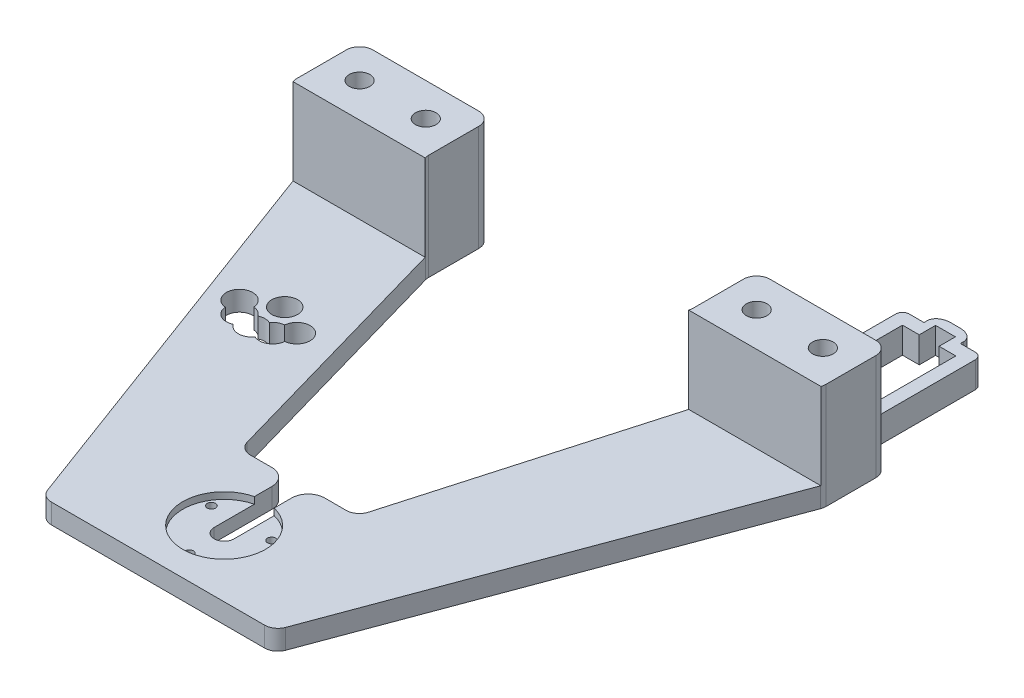
from build123d import *

# Parameters (mm, degrees)
SKETCH1_R            = 3.96875
BOSS_EXTRUDE2_DEPTH  = 40.64
SKETCH4_R            = 1.5875
CUT_EXTRUDE1_DEPTH   = 210.749095026
CUT_EXTRUDE2_START   = 5.08
SKETCH5_R            = 15.875
CUT_EXTRUDE2_DEPTH   = 5.08
SKETCH7_W            = 321.437634852
SKETCH7_H            = 153.081921076
CUT_EXTRUDE3_DEPTH   = 33.02
CUT_EXTRUDE5_DEPTH   = 210.749095026
FILLET1_R            = 6.35
FILLET2_R            = 6.35
EXTRUDE_THIN1_DEPTH  = 10
SKETCH14_R           = 1.950000064
CUT_EXTRUDE6_DEPTH   = 20
BOSS_EXTRUDE4_DEPTH  = 5
MIRROR5_COPY_1_DEPTH = 5
FILLET3_R            = 2.54
SKETCH20_W           = 13.97
SKETCH20_H           = 5.08
BOSS_EXTRUDE5_DEPTH  = 10
FILLET7_SIZE         = 3.81
FILLET7_SIZE_2       = 5.08
FILLET6_SIZE         = 3.81
FILLET6_SIZE_2       = 5.08
CUT_EXTRUDE10_START  = -5
SKETCH19_W           = 7.62
SKETCH19_H           = 10.16
CUT_EXTRUDE10_DEPTH  = 6.27
MIRROR6_OUTLINE_W    = 7.62
MIRROR6_OUTLINE_H    = 5
MIRROR6_DEPTH        = 10
MIRROR6_2_DEPTH      = 10
SKETCH21_W           = 77.087164644
SKETCH21_H           = 69.073945867
CUT_EXTRUDE11_DEPTH  = 210.74909516
SKETCH23_R           = 5.08
CUT_EXTRUDE12_DEPTH  = 255.54404949
SKETCH22_R           = 4.953
CUT_EXTRUDE13_DEPTH  = 255.54404949


# Read off the part's stored shape, not the designer's step: Mirror6
with BuildPart() as part:
    # Sketch1 → Boss-Extrude2 (new body)
    with BuildSketch(Plane(origin=(0, 0, 0), x_dir=(1, 0, 0), z_dir=(0, 1, 0))):
        with BuildLine():
            Line((-96.52, 178.942765331), (-55.88, 178.942765331))
            ThreePointArc((-55.88, 178.942765331), (-52.287897552, 177.454867779), (-50.8, 173.862765331))
            Line((-50.8, 173.862765331), (-50.8, 154.610881096))
            ThreePointArc((-50.8, 154.610881096), (-50.750979429, 153.906859803), (-50.604863787, 153.216425724))
            Line((-50.604863787, 153.216425724), (-23.277092285, 57.485544628))
            ThreePointArc((-23.277092285, 57.485544628), (-21.451849938, 54.824742099), (-18.392228498, 53.8))
            Line((-18.392228498, 53.8), (0, 53.8))
            Line((0, 53.8), (0, 0))
            Line((0, 0), (-40.91748188, 0))
            ThreePointArc((-40.91748188, 0), (-43.817717665, 0.909264766), (-45.679732106, 3.31156205))
            Line((-45.679732106, 3.31156205), (-101.282250226, 153.044327381))
            ThreePointArc((-101.282250226, 153.044327381), (-101.519931557, 153.914386555), (-101.6, 154.812765331))
            Line((-101.6, 154.812765331), (-101.6, 173.862765331))
            ThreePointArc((-101.6, 173.862765331), (-100.112102448, 177.454867779), (-96.52, 178.942765331))
        make_face()
        with Locations(Location((-88.9, 166.242765331, 0), (0, 0, 270))):
            Circle(SKETCH1_R, mode=Mode.SUBTRACT)
        with Locations(Location((-63.5, 166.242765331, 0), (0, 0, 270))):
            Circle(SKETCH1_R, mode=Mode.SUBTRACT)
    boss_extrude2 = extrude(amount=BOSS_EXTRUDE2_DEPTH)

    # Mirror1: Boss-Extrude2 across plane
    add(boss_extrude2.mirror(Plane(origin=(0, 40.64, -53.8), x_dir=(0, 0, 1), z_dir=(-1, 0, 0))))

    # Sketch4 → Cut-Extrude1 (cut, through all)
    with BuildSketch(Plane(origin=(0, 40.64, 0), x_dir=(1, 0, 0), z_dir=(0, 1, 0))):
        with Locations(Location((11.548448759, 32.0195, 0), (0, 0, 270))):
            Circle(SKETCH4_R)
        with Locations(Location((0, 12.017, 0), (0, 0, 270))):
            Circle(SKETCH4_R)
        with Locations(Location((-11.548448759, 32.0195, 0), (0, 0, 270))):
            Circle(SKETCH4_R)
    extrude(amount=-CUT_EXTRUDE1_DEPTH, mode=Mode.SUBTRACT)

    # Sketch5 → Cut-Extrude2 (cut)
    with BuildSketch(Plane(origin=(0, 0, 0), x_dir=(1, 0, 0), z_dir=(0, 1, 0)).offset(CUT_EXTRUDE2_START)):
        with Locations(Location((0, 25.352, 0), (0, 0, 270))):
            Circle(SKETCH5_R)
    extrude(amount=CUT_EXTRUDE2_DEPTH, mode=Mode.SUBTRACT)

    # Sketch7 → Cut-Extrude3 (cut)
    with BuildSketch(Plane(origin=(0, 40.64, 0), x_dir=(1, 0, 0), z_dir=(0, 1, 0))):
        with Locations((5.589227859, 76.540960538)):
            Rectangle(SKETCH7_W, SKETCH7_H)
    extrude(amount=-CUT_EXTRUDE3_DEPTH, mode=Mode.SUBTRACT)

    # Sketch8 → Cut-Extrude5 (cut, through all)
    with BuildSketch(Plane(origin=(0, 0, 0), x_dir=(1, 0, 0), z_dir=(0, 1, 0))):
        with BuildLine():
            Line((-3.81, 25.352), (-3.81, 53.8))
            ThreePointArc((-3.81, 53.8), (0, 57.61), (3.81, 53.8))
            Line((3.81, 53.8), (3.81, 25.352))
            ThreePointArc((3.81, 25.352), (0, 21.542), (-3.81, 25.352))
        make_face()
    extrude(amount=CUT_EXTRUDE5_DEPTH, mode=Mode.SUBTRACT)

    # Fillet1
    fillet1_edges = [part.edges().sort_by_distance(p)[0] for p in [
        (-3.81, 3.81, -53.8),
    ]]
    fillet(fillet1_edges, radius=FILLET1_R)

    # Fillet2
    fillet2_edges = [part.edges().sort_by_distance(p)[0] for p in [
        (3.81, 3.81, -53.8),
    ]]
    fillet(fillet2_edges, radius=FILLET2_R)

    # Sketch9 → Extrude-Thin1 (add)
    with BuildSketch(Plane(origin=(0, 0, 0), x_dir=(1, 0, 0), z_dir=(0, 1, 0))):
        Polygon((-91.44, 173.942765331), (-91.44, 224.742765331), (-60.96, 224.742765331), (-60.96, 173.942765331), (-65.96, 173.942765331), (-65.96, 219.742765331), (-86.44, 219.742765331), (-86.44, 173.942765331), align=None)
    extrude_thin1 = extrude(amount=EXTRUDE_THIN1_DEPTH)

    # Sketch14 → Cut-Extrude6 (cut)
    with BuildSketch(Plane.XZ):
        with Locations(Location((-81.2, -174.942765331, 0), (0, 0, 270))):
            Circle(SKETCH14_R)
        with Locations(Location((-71.2, -174.942765331, 0), (0, 0, 270))):
            Circle(SKETCH14_R)
    cut_extrude6 = extrude(amount=-CUT_EXTRUDE6_DEPTH, mode=Mode.SUBTRACT)

    # Sketch18 → Boss-Extrude4 (add)
    with BuildSketch(Plane(origin=(-60.96, 10, -178.942765331), x_dir=(0, 0, 1), z_dir=(-1, 0, 0))):
        Polygon((-1.27, 0), (0, 1.524), (0, 0), align=None)
    boss_extrude4 = extrude(amount=BOSS_EXTRUDE4_DEPTH)

    # Mirror3: Boss-Extrude4 across plane
    add(boss_extrude4.mirror(Plane(origin=(-76.2, 0, 0), x_dir=(0, 0, 1), z_dir=(1, 0, 0))))

    # Mirror5: Extrude-Thin1, Cut-Extrude6, Boss-Extrude4 across plane
    add(extrude_thin1.mirror(Plane(origin=(0, 0, 0), x_dir=(0, 0, 1), z_dir=(1, 0, 0))))
    add(cut_extrude6.mirror(Plane(origin=(0, 0, 0), x_dir=(0, 0, 1), z_dir=(1, 0, 0))), mode=Mode.SUBTRACT)
    add(boss_extrude4.mirror(Plane(origin=(0, 0, 0), x_dir=(0, 0, 1), z_dir=(1, 0, 0))))

    # Mirror5 copy 1 sketch → Mirror5 copy 1 (add)
    with BuildSketch(Plane(origin=(91.44, 10, -178.942765331), x_dir=(0, 0, 1), z_dir=(-1, 0, 0))):
        Polygon((-1.27, 0), (0, 1.524), (0, 0), align=None)
    extrude(amount=MIRROR5_COPY_1_DEPTH)

    # Fillet3
    fillet3_edges = [part.edges().sort_by_distance(p)[0] for p in [
        (-91.44, 5, -224.742765331),
        (-60.96, 5, -224.742765331),
        (91.44, 5, -224.742765331),
        (60.96, 5, -224.742765331),
    ]]
    fillet(fillet3_edges, radius=FILLET3_R)

    # Sketch20 → Boss-Extrude5 (add)
    with BuildSketch(Plane(origin=(0, 0, 0), x_dir=(1, 0, 0), z_dir=(0, 1, 0))):
        with Locations((-76.2, 227.282765331)):
            Rectangle(SKETCH20_W, SKETCH20_H)
    extrude(amount=BOSS_EXTRUDE5_DEPTH)

    # Fillet7
    # an asymmetric fillet: 5.08, 3.81 mm, written as the material it takes off along each edge
    with BuildSketch(Plane(origin=(-83.185, -12.7, -229.822765331), x_dir=(0, 0, 1), z_dir=(0, 1, 0))) as fillet7_piece_1:
        with BuildLine():
            Bezier((FILLET7_SIZE, 0), (0, 0), (0, FILLET7_SIZE_2), weights=[1, 0.707106781, 1])
            Line((0, FILLET7_SIZE_2), (0, 0))
            Line((0, 0), (FILLET7_SIZE, 0))
        make_face()
    extrude(amount=35.4, mode=Mode.SUBTRACT)

    # Fillet6
    # an asymmetric fillet: 5.08, 3.81 mm, written as the material it takes off along each edge
    with BuildSketch(Plane(origin=(-69.215, -12.7, -229.822765331), x_dir=(0, 0, 1), z_dir=(0, 1, 0))) as fillet6_piece_1:
        with BuildLine():
            Bezier((FILLET6_SIZE, 0), (0, 0), (0, -FILLET6_SIZE_2), weights=[1, 0.707106781, 1])
            Line((0, -FILLET6_SIZE_2), (0, 0))
            Line((0, 0), (FILLET6_SIZE, 0))
        make_face()
    extrude(amount=35.4, mode=Mode.SUBTRACT)

    # Sketch19 → Cut-Extrude10 (cut)
    with BuildSketch(Plane(origin=(0, 0, -224.742765331), x_dir=(-1, 0, 0), z_dir=(0, 0, -1)).offset(CUT_EXTRUDE10_START)):
        with Locations((76.2, 4.92)):
            Rectangle(SKETCH19_W, SKETCH19_H)
    extrude(amount=CUT_EXTRUDE10_DEPTH, mode=Mode.SUBTRACT)

    # Mirror6 outline → Mirror6 (cut)
    with BuildSketch(Plane(origin=(0, 0, 0), x_dir=(1, 0, 0), z_dir=(0, 1, 0))):
        with Locations((76.2, 222.242765331)):
            Rectangle(MIRROR6_OUTLINE_W, MIRROR6_OUTLINE_H)
    extrude(amount=MIRROR6_DEPTH, mode=Mode.SUBTRACT)

    # Mirror6 2 outline → Mirror6 2 (add)
    with BuildSketch(Plane(origin=(0, 0, 0), x_dir=(1, 0, 0), z_dir=(0, 1, 0))):
        with BuildLine():
            add(Edge.make_bspline(
                [(78.105, 229.822765331), (83.185, 229.822765331), (83.185, 226.012765331)],
                knots=[0, 0, 0, 1, 1, 1], degree=2, weights=[1, 0.707106781, 1]))
            Line((78.105, 229.822765331), (74.295, 229.822765331))
            add(Edge.make_bspline(
                [(69.215, 226.012765331), (69.215, 229.822765331), (74.295, 229.822765331)],
                knots=[0, 0, 0, 1, 1, 1], degree=2, weights=[1, 0.707106781, 1]))
            Line((69.215, 226.012765331), (69.215, 224.742765331))
            Line((69.215, 224.742765331), (72.39, 224.742765331))
            Line((72.39, 224.742765331), (72.39, 226.012765331))
            Line((72.39, 226.012765331), (80.01, 226.012765331))
            Line((80.01, 226.012765331), (80.01, 224.742765331))
            Line((80.01, 224.742765331), (83.185, 224.742765331))
            Line((83.185, 224.742765331), (83.185, 226.012765331))
        make_face()
    extrude(amount=MIRROR6_2_DEPTH)

    # Sketch21 → Cut-Extrude11 (cut, through all)
    with BuildSketch(Plane(origin=(0, 0, -178.942765331), x_dir=(-1, 0, 0), z_dir=(0, 0, -1))):
        with Locations((78.752430528, 22.788762469)):
            Rectangle(SKETCH21_W, SKETCH21_H)
    extrude(amount=CUT_EXTRUDE11_DEPTH, mode=Mode.SUBTRACT)

    # Sketch23 → Cut-Extrude12 (cut, through all)
    with BuildSketch(Plane.XZ):
        with Locations((-67.31, -98.573931837)):
            Circle(SKETCH23_R)
        with Locations((-71.958522628, -103.222454465)):
            Circle(SKETCH23_R)
        with Locations((-60.96, -96.872454465)):
            Circle(SKETCH23_R)
        with Locations((-54.61, -98.573931837)):
            Circle(SKETCH23_R)
        with Locations((-49.961477372, -103.222454465)):
            Circle(SKETCH23_R)
    extrude(amount=-CUT_EXTRUDE12_DEPTH, mode=Mode.SUBTRACT)

    # Sketch22 → Cut-Extrude13 (cut, through all)
    with BuildSketch(Plane.XZ):
        with Locations(Location((-60.96, -109.572454465, 0), (0, 0, 270))):
            Circle(SKETCH22_R)
    extrude(amount=-CUT_EXTRUDE13_DEPTH, mode=Mode.SUBTRACT)


solid = part.part
